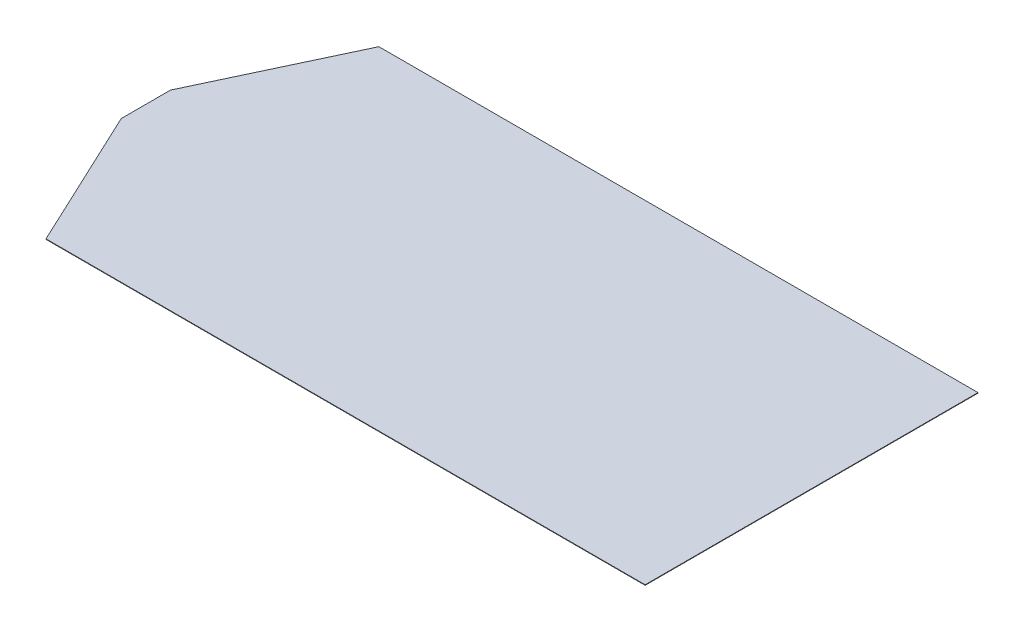
from build123d import *

# Parameters (mm, degrees)
BASE_FLANGIA1_DEPTH = 1.5


# Sheet-metal steps are written as plain solids
with BuildPart() as part:
    # Schizzo1 → Base-Flangia1 (new body)
    with BuildSketch(Plane(origin=(0, 0, 0), x_dir=(1, 0, 0), z_dir=(0, 1, 0))):
        Polygon((-900, 500), (-1100, 74), (-1100, -74), (-900, -500), (900, -500), (900, 500), align=None)
    extrude(amount=-BASE_FLANGIA1_DEPTH)


solid = part.part
